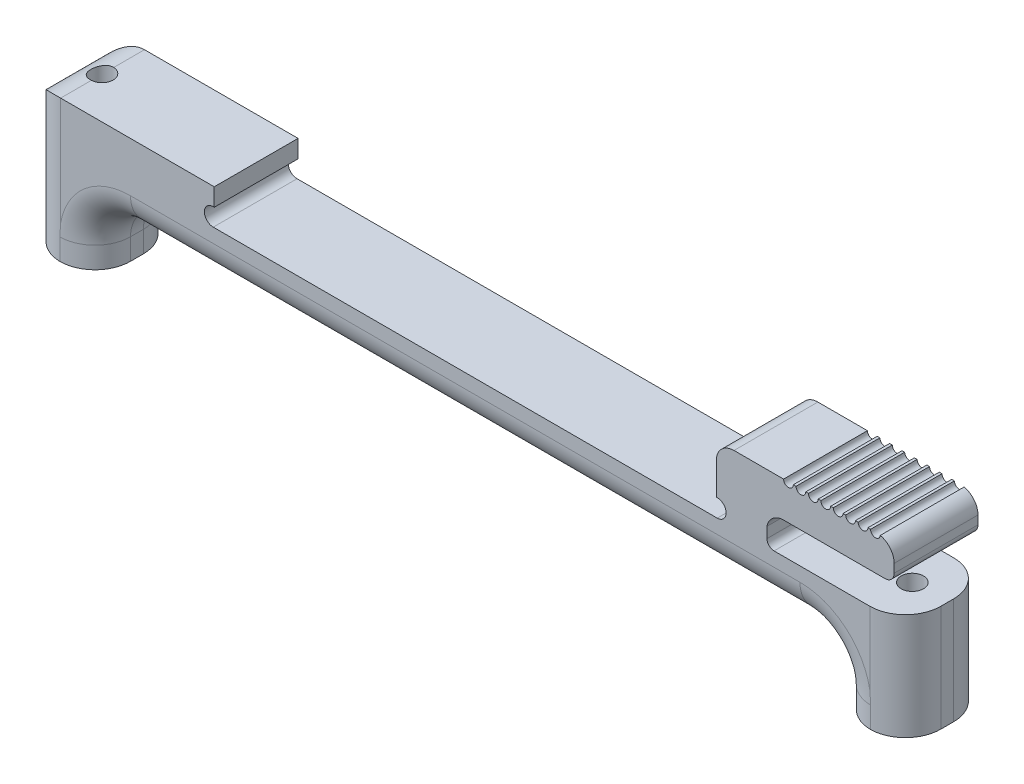
from build123d import *

# Parameters (mm, degrees)
BOSS_EXTRUDE1_DEPTH   = 6
M2X0_4_TAPPED_HOLE1_D = 1.6
FILLET1_R             = 2.54
SKETCH4_W             = 9.9041
SKETCH4_H             = 2.536063356
CUT_EXTRUDE1_DEPTH    = 34.630699773
BOSS_EXTRUDE2_DEPTH   = 6
FILLET2_R             = 0.508


with BuildPart() as part:
    # Sketch1 → Boss-Extrude1 (new body)
    with BuildSketch(Plane.XY):
        with BuildLine():
            Line((-31.4941, 0), (-26.4941, 0))
            Line((-26.4941, 0), (-26.4941, 1.524))
            ThreePointArc((-26.4941, 1.524), (-25.750151224, 3.320051224), (-23.9541, 4.064))
            Line((-23.9541, 4.064), (23.9541, 4.064))
            ThreePointArc((23.9541, 4.064), (25.750151224, 3.320051224), (26.4941, 1.524))
            Line((26.4941, 1.524), (26.4941, 0))
            Line((26.4941, 0), (31.4941, 0))
            Line((31.4941, 0), (31.4941, 10.156063356))
            Line((31.4941, 10.156063356), (17.963402264, 10.156063356))
            Line((17.963402264, 10.156063356), (17.963402264, 8.886063356))
            ThreePointArc((17.963402264, 8.886063356), (18.668015075, 8.290353704), (18.034, 7.62))
            Line((18.034, 7.62), (-18.034, 7.62))
            ThreePointArc((-18.034, 7.62), (-18.668015075, 8.290353704), (-17.963402264, 8.886063356))
            Line((-17.963402264, 8.886063356), (-17.963402264, 10.156063356))
            Line((-17.963402264, 10.156063356), (-31.4941, 10.156063356))
            Line((-31.4941, 10.156063356), (-31.4941, 0))
        make_face()
    extrude(amount=BOSS_EXTRUDE1_DEPTH)

    # M2x0.4 Tapped Hole1 (through all)
    with Locations(Plane(origin=(0, 0, 0), x_dir=(-1, 0, 0), z_dir=(0, -1, 0))):
        with Locations((28.9941, -3), (-28.9941, -3)):
            Hole(M2X0_4_TAPPED_HOLE1_D / 2)

    # Fillet1
    # the kernel refuses this fillet: 2.54 mm, written as the material it takes off along each edge
    with BuildSketch(Plane(origin=(-26.4941, -6.35, 0), x_dir=(-1, 0, 0), z_dir=(0, 1, 0)), Plane(origin=(26.4941, 1.524, 0), x_dir=(1, 0, 0), z_dir=(0, -1, 0))) as fillet1_piece_1:
        with BuildLine():
            CenterArc((FILLET1_R, FILLET1_R), FILLET1_R, 180, 90)
            Line((0, FILLET1_R), (0, 0))
            Line((0, 0), (FILLET1_R, 0))
        make_face()
    extrude(amount=7.874, mode=Mode.SUBTRACT)
    with BuildSketch(Plane(origin=(-23.9541, 1.524, 0), x_dir=(-1, 0, 0), z_dir=(0, -1, 0))) as fillet1_piece_2:
        with BuildLine():
            CenterArc((2.54 + FILLET1_R, -FILLET1_R), FILLET1_R, 90, 90)
            Line((2.54, -FILLET1_R), (2.54, 0))
            Line((2.54, 0), (2.54 + FILLET1_R, 0))
        make_face()
    revolve(axis=Axis((-23.9541, 1.524, 0), (0, 0, -1)), revolution_arc=90, mode=Mode.SUBTRACT)
    with BuildSketch(Plane(origin=(23.9541, 1.524, 0), x_dir=(0, 1, 0), z_dir=(-1, 0, 0))) as fillet1_piece_3:
        with BuildLine():
            CenterArc((2.54 + FILLET1_R, -FILLET1_R), FILLET1_R, 90, 90)
            Line((2.54, -FILLET1_R), (2.54, 0))
            Line((2.54, 0), (2.54 + FILLET1_R, 0))
        make_face()
    revolve(axis=Axis((23.9541, 1.524, 0), (0, 0, -1)), revolution_arc=90, mode=Mode.SUBTRACT)
    with BuildSketch(Plane(origin=(-26.4941, -6.35, 6), x_dir=(-1, 0, 0), z_dir=(0, 1, 0)), Plane(origin=(26.4941, 1.524, 6), x_dir=(1, 0, 0), z_dir=(0, -1, 0))) as fillet1_piece_4:
        with BuildLine():
            CenterArc((FILLET1_R, -FILLET1_R), FILLET1_R, 90, 90)
            Line((0, -FILLET1_R), (0, 0))
            Line((0, 0), (FILLET1_R, 0))
        make_face()
    extrude(amount=7.874, mode=Mode.SUBTRACT)
    with BuildSketch(Plane(origin=(-23.9541, 1.524, 6), x_dir=(-1, 0, 0), z_dir=(0, -1, 0))) as fillet1_piece_5:
        with BuildLine():
            CenterArc((2.54 + FILLET1_R, FILLET1_R), FILLET1_R, 180, 90)
            Line((2.54, FILLET1_R), (2.54, 0))
            Line((2.54, 0), (2.54 + FILLET1_R, 0))
        make_face()
    revolve(axis=Axis((-23.9541, 1.524, 6), (0, 0, -1)), revolution_arc=90, mode=Mode.SUBTRACT)
    with BuildSketch(Plane(origin=(-23.9541, 4.064, 6), x_dir=(0, 1, 0), z_dir=(1, 0, 0))) as fillet1_piece_6:
        with BuildLine():
            CenterArc((FILLET1_R, -FILLET1_R), FILLET1_R, 90, 90)
            Line((0, -FILLET1_R), (0, 0))
            Line((0, 0), (FILLET1_R, 0))
        make_face()
    extrude(amount=47.9082, mode=Mode.SUBTRACT)
    with BuildSketch(Plane(origin=(23.9541, 1.524, 6), x_dir=(0, 1, 0), z_dir=(-1, 0, 0))) as fillet1_piece_7:
        with BuildLine():
            CenterArc((2.54 + FILLET1_R, FILLET1_R), FILLET1_R, 180, 90)
            Line((2.54, FILLET1_R), (2.54, 0))
            Line((2.54, 0), (2.54 + FILLET1_R, 0))
        make_face()
    revolve(axis=Axis((23.9541, 1.524, 6), (0, 0, -1)), revolution_arc=90, mode=Mode.SUBTRACT)
    with BuildSketch(Plane(origin=(-31.4941, 16.506063356, 0), x_dir=(1, 0, 0), z_dir=(0, -1, 0)), Plane(origin=(31.4941, -6.35, 0), x_dir=(-1, 0, 0), z_dir=(0, 1, 0))) as fillet1_piece_8:
        with BuildLine():
            CenterArc((FILLET1_R, FILLET1_R), FILLET1_R, 180, 90)
            Line((0, FILLET1_R), (0, 0))
            Line((0, 0), (FILLET1_R, 0))
        make_face()
    extrude(amount=22.856063356, mode=Mode.SUBTRACT)
    with BuildSketch(Plane(origin=(-31.4941, 16.506063356, 6), x_dir=(1, 0, 0), z_dir=(0, -1, 0)), Plane(origin=(31.4941, -6.35, 6), x_dir=(-1, 0, 0), z_dir=(0, 1, 0))) as fillet1_piece_9:
        with BuildLine():
            CenterArc((FILLET1_R, -FILLET1_R), FILLET1_R, 90, 90)
            Line((0, -FILLET1_R), (0, 0))
            Line((0, 0), (FILLET1_R, 0))
        make_face()
    extrude(amount=22.856063356, mode=Mode.SUBTRACT)
    with BuildSketch(Plane(origin=(-23.9541, 4.064, 0), x_dir=(0, 1, 0), z_dir=(1, 0, 0))) as fillet1_piece_10:
        with BuildLine():
            CenterArc((FILLET1_R, FILLET1_R), FILLET1_R, 180, 90)
            Line((0, FILLET1_R), (0, 0))
            Line((0, 0), (FILLET1_R, 0))
        make_face()
    extrude(amount=47.9082, mode=Mode.SUBTRACT)
    with BuildSketch(Plane(origin=(31.4941, 10.156063356, -6.35), x_dir=(0, -1, 0), z_dir=(0, 0, 1)), Plane(origin=(-31.4941, 10.156063356, -6.35), x_dir=(1, 0, 0), z_dir=(0, 0, 1))) as fillet1_piece_11:
        with BuildLine():
            CenterArc((FILLET1_R, -FILLET1_R), FILLET1_R, 90, 90)
            Line((0, -FILLET1_R), (0, 0))
            Line((0, 0), (FILLET1_R, 0))
        make_face()
    extrude(amount=18.7, mode=Mode.SUBTRACT)

    # Sketch4 → Cut-Extrude1 (cut, through all)
    with BuildSketch(Plane.XY.offset(6)):
        with Locations((26.54205, 8.888031678)):
            Rectangle(SKETCH4_W, SKETCH4_H)
    extrude(amount=-CUT_EXTRUDE1_DEPTH, mode=Mode.SUBTRACT)

    # Sketch5 → Boss-Extrude2 (add)
    with BuildSketch(Plane.XY.offset(6)):
        with BuildLine():
            Line((22.781680466, 9.873540862), (30.033107734, 9.873540862))
            ThreePointArc((30.033107734, 9.873540862), (30.500081052, 10.066967543), (30.693507734, 10.533940862))
            Line((30.693507734, 10.533940862), (30.693507734, 11.143540862))
            ThreePointArc((30.693507734, 11.143540862), (30.414801602, 11.937415201), (29.701009362, 12.382852302))
            ThreePointArc((29.701009362, 12.382852302), (29.338161991, 12.065038452), (29.004680466, 12.413540862))
            Line((29.004680466, 12.413540862), (28.813361866, 12.413540862))
            ThreePointArc((28.813361866, 12.413540862), (28.464521166, 12.064700162), (28.115680466, 12.413540862))
            Line((28.115680466, 12.413540862), (27.924361866, 12.413540862))
            ThreePointArc((27.924361866, 12.413540862), (27.575521166, 12.064700162), (27.226680466, 12.413540862))
            Line((27.226680466, 12.413540862), (27.035361866, 12.413540862))
            ThreePointArc((27.035361866, 12.413540862), (26.686521166, 12.064700162), (26.337680466, 12.413540862))
            Line((26.337680466, 12.413540862), (26.146361866, 12.413540862))
            ThreePointArc((26.146361866, 12.413540862), (25.797521166, 12.064700162), (25.448680466, 12.413540862))
            Line((25.448680466, 12.413540862), (25.257361866, 12.413540862))
            ThreePointArc((25.257361866, 12.413540862), (24.908521166, 12.064700162), (24.559680466, 12.413540862))
            Line((24.559680466, 12.413540862), (24.368361866, 12.413540862))
            ThreePointArc((24.368361866, 12.413540862), (24.019521166, 12.064700162), (23.670680466, 12.413540862))
            Line((23.670680466, 12.413540862), (23.479361866, 12.413540862))
            ThreePointArc((23.479361866, 12.413540862), (23.130521166, 12.064700162), (22.781680466, 12.413540862))
            Line((22.781680466, 12.413540862), (19.233402264, 12.413540862))
            ThreePointArc((19.233402264, 12.413540862), (18.335376652, 12.041566474), (17.963402264, 11.143540862))
            Line((17.963402264, 11.143540862), (17.963402264, 10.156063356))
            Line((17.963402264, 10.156063356), (21.59, 10.156063356))
            Line((21.59, 10.156063356), (21.59, 8.888031678))
            ThreePointArc((21.59, 8.888031678), (22.008484067, 9.595245842), (22.781680466, 9.873540862))
        make_face()
    extrude(amount=-BOSS_EXTRUDE2_DEPTH)

    # Fillet2
    fillet2_edges = [part.edges().sort_by_distance(p)[0] for p in [
        (21.59, 7.62, 3),
    ]]
    fillet(fillet2_edges, radius=FILLET2_R)


solid = part.part
